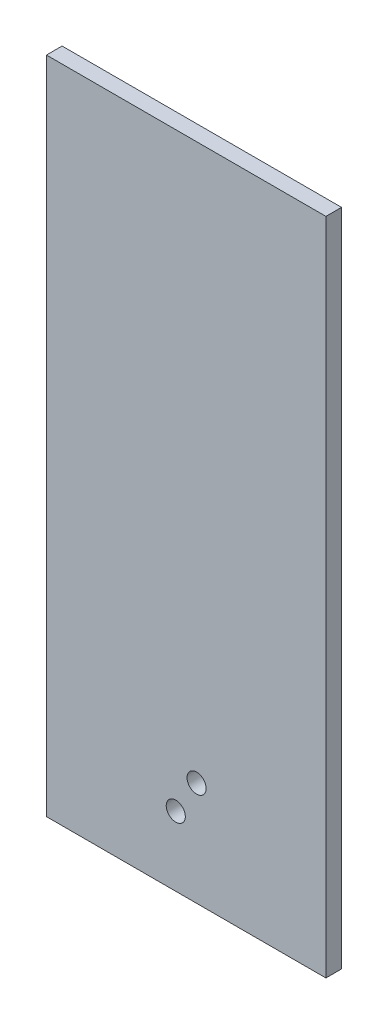
from build123d import *

# Parameters (mm, degrees)
SKETCH1_W           = 161
SKETCH1_H           = 380
BOSS_EXTRUDE1_DEPTH = 9
SKETCH2_R           = 5.5
CUT_EXTRUDE1_DEPTH  = 207.545999719


with BuildPart() as part:
    # Sketch1 → Boss-Extrude1 (new body)
    with BuildSketch(Plane.XY):
        Rectangle(SKETCH1_W, SKETCH1_H)
    extrude(amount=BOSS_EXTRUDE1_DEPTH)

    # Sketch2 → Cut-Extrude1 (cut, through all)
    with BuildSketch(Plane.XY.offset(9)):
        with Locations((6, -130)):
            Circle(SKETCH2_R)
        with Locations((-6, -150)):
            Circle(SKETCH2_R)
    extrude(amount=-CUT_EXTRUDE1_DEPTH, mode=Mode.SUBTRACT)


solid = part.part
